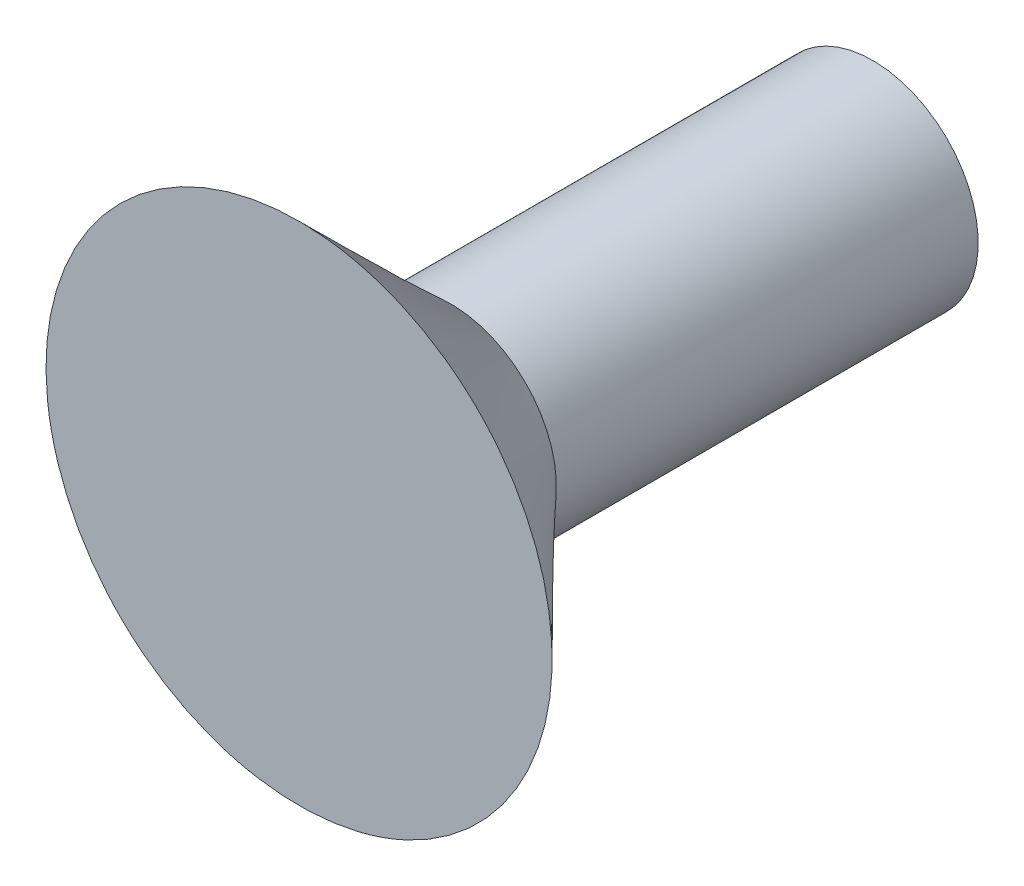
from build123d import *

# Parameters (mm, degrees)
SZKIC6_R                    = 1.25
DODANIE_WYCI_GNI_CIE2_DEPTH = 5


with BuildPart() as part:
    # Wyciągnięcie po profilach1: read off the stored shape, not the designer's step
    # Wyciągnięcie po profilach1: loft between two sections, ruled curve by curve
    wyci_gni_cie_po_profilach1_from = [
        Edge.make_bspline([(0.872144306, 4.699971596, 9.190785956), (-0.918793224, 6.444260208, 9.190785956), (-2.663081836, 4.653322679, 9.190785956), (-0.872144306, 2.909034066, 9.190785956), (0.918793224, 1.164745453, 9.190785956), (2.663081836, 2.955682983, 9.190785956), (0.872144306, 4.699971596, 9.190785956)], [0, 0, 0, 0, 0.5, 0.5, 0.5, 1, 1, 1, 1], 3, [1, 0.333333333, 0.333333333, 1, 0.333333333, 0.333333333, 1]),
    ]
    wyci_gni_cie_po_profilach1_to = [
        Edge.make_bspline([(1.469973455, 6.41968505, 10.990785956), (-3.760390984, 9.35963196, 10.990785956), (-6.700337894, 4.129267521, 10.990785956), (-1.469973455, 1.189320611, 10.990785956), (3.760390984, -1.750626299, 10.990785956), (6.700337894, 3.479738141, 10.990785956), (1.469973455, 6.41968505, 10.990785956)], [0, 0, 0, 0, 0.5, 0.5, 0.5, 1, 1, 1, 1], 3, [1, 0.333333333, 0.333333333, 1, 0.333333333, 0.333333333, 1]),
    ]
    wyci_gni_cie_po_profilach1 = Solid(Shell([*[Face.make_surface_from_curves(wyci_gni_cie_po_profilach1_from[k], wyci_gni_cie_po_profilach1_to[k]) for k in range(1)], Face(Wire(wyci_gni_cie_po_profilach1_from)), Face(Wire(wyci_gni_cie_po_profilach1_to))]))
    add(wyci_gni_cie_po_profilach1)

    # Szkic6 → Dodanie-wyciągnięcie2 (add)
    with BuildSketch(Plane(origin=(0, 0, 9.190785956), x_dir=(-1, 0, 0), z_dir=(0, 0, -1))):
        with Locations(Location((0, 3.804502831, 0), (0, 0, 134.244))):
            Circle(SZKIC6_R)
    extrude(amount=DODANIE_WYCI_GNI_CIE2_DEPTH)


solid = part.part
